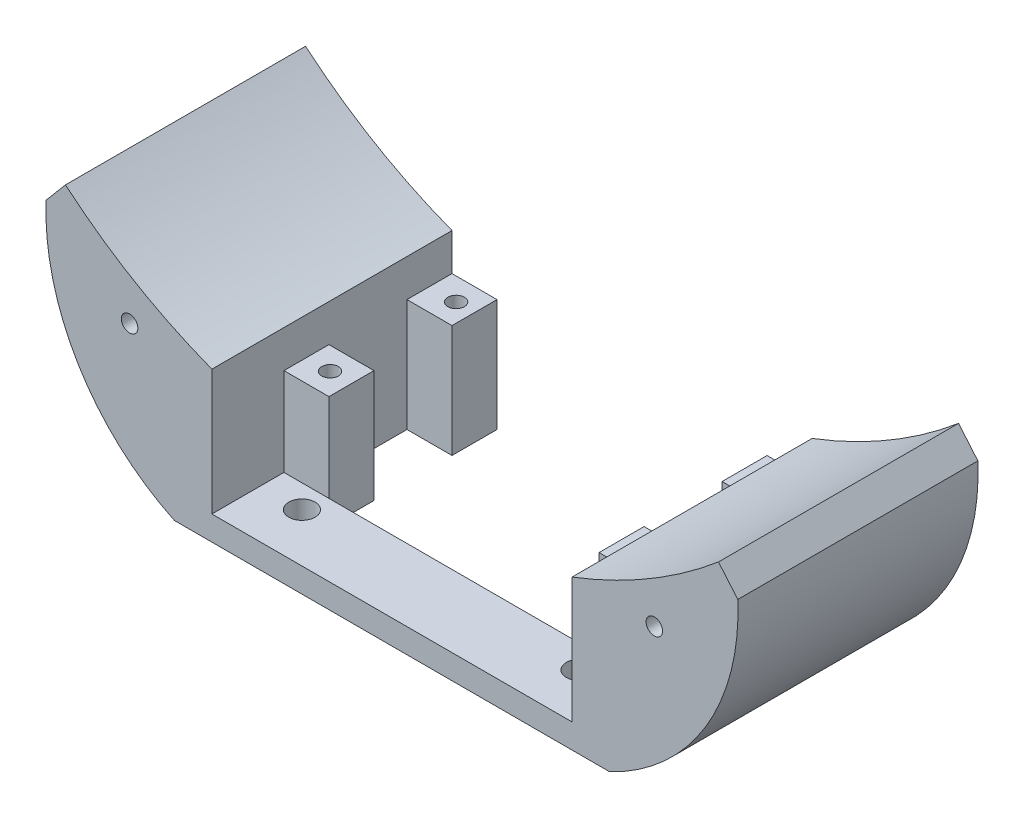
from build123d import *

# Parameters (mm, degrees)
DODANIE_WYCI_GNI_CIE1_DEPTH = 32
SZKIC2_W                    = 48
SZKIC2_H                    = 11.75
WYTNIJ_WYCI_GNI_CIE3_DEPTH  = 9.6
SZKIC3_R                    = 1.1
WYTNIJ_WYCI_GNI_CIE4_DEPTH  = 2347.191242671
SZKIC4_R                    = 1.75
WYTNIJ_WYCI_GNI_CIE5_DEPTH  = 2347.303180118
SZKIC5_R                    = 1.1
WYTNIJ_WYCI_GNI_CIE6_DEPTH  = 2522.724595802


with BuildPart() as part:
    # Szkic1 → Dodanie-wyciągnięcie1 (new body)
    with BuildSketch(Plane.XY):
        with BuildLine():
            Line((2328.79361311, 893.051829713), (2270.79361311, 893.051829713))
            ThreePointArc((2270.79361311, 893.051829713), (2257.958035193, 904.689770402), (2253.698103307, 921.484016567))
            Line((2253.698103307, 921.484016567), (2256.269323768, 924.528567861))
            ThreePointArc((2256.269323768, 924.528567861), (2265.544803434, 917.949778707), (2275.79361311, 913.0226203))
            Line((2275.79361311, 913.0226203), (2275.79361311, 908.051829713))
            Line((2275.79361311, 908.051829713), (2323.79361311, 908.051829713))
            Line((2323.79361311, 908.051829713), (2323.79361311, 913.024063057))
            ThreePointArc((2323.79361311, 913.024063057), (2334.040379887, 917.950808108), (2343.314112837, 924.528567861))
            Line((2343.314112837, 924.528567861), (2345.885333298, 921.484016567))
            ThreePointArc((2345.885333298, 921.484016567), (2341.626993346, 904.690523978), (2328.79361311, 893.051829713))
        make_face()
    extrude(amount=DODANIE_WYCI_GNI_CIE1_DEPTH)

    # Szkic2 → Wytnij-wyciągnięcie3 (cut)
    with BuildSketch(Plane.XY.offset(32)):
        with Locations((2299.79361311, 902.176829713)):
            Rectangle(SZKIC2_W, SZKIC2_H)
    extrude(amount=-WYTNIJ_WYCI_GNI_CIE3_DEPTH, mode=Mode.SUBTRACT)

    # Szkic3 → Wytnij-wyciągnięcie4 (cut, through all)
    with BuildSketch(Plane(origin=(0, 908.051829713, 0), x_dir=(1, 0, 0), z_dir=(0, 1, 0))):
        with Locations((2320.04361311, -19.4)):
            Circle(SZKIC3_R)
        with Locations((2320.44361311, -3)):
            Circle(SZKIC3_R)
        with Locations((2279.34361311, -3)):
            Circle(SZKIC3_R)
        with Locations((2278.94361311, -19.4)):
            Circle(SZKIC3_R)
        Polygon((2323.79361311, -16.4), (2317.79361311, -16.4), (2317.79361311, -22.4), (2281.79361311, -22.4), (2281.79361311, -16.4), (2275.79361311, -16.4), (2275.79361311, -6), (2281.79361311, -6), (2281.79361311, 0), (2317.79361311, 0), (2317.79361311, -6), (2323.79361311, -6), align=None)
    extrude(amount=-WYTNIJ_WYCI_GNI_CIE4_DEPTH, mode=Mode.SUBTRACT)

    # Szkic4 → Wytnij-wyciągnięcie5 (cut, through all)
    with BuildSketch(Plane(origin=(0, 896.301829713, 0), x_dir=(1, 0, 0), z_dir=(0, 1, 0))):
        with Locations((2318.29361311, -25.5)):
            Circle(SZKIC4_R)
        with Locations((2281.29361311, -25.5)):
            Circle(SZKIC4_R)
    extrude(amount=-WYTNIJ_WYCI_GNI_CIE5_DEPTH, mode=Mode.SUBTRACT)

    # Szkic5 → Wytnij-wyciągnięcie6 (cut, through all)
    with BuildSketch(Plane.XY.offset(32)):
        with Locations((2334.760691049, 912.809668955)):
            Circle(SZKIC5_R)
        with Locations((2264.822745556, 912.809668955)):
            Circle(SZKIC5_R)
    extrude(amount=-WYTNIJ_WYCI_GNI_CIE6_DEPTH, mode=Mode.SUBTRACT)


solid = part.part
